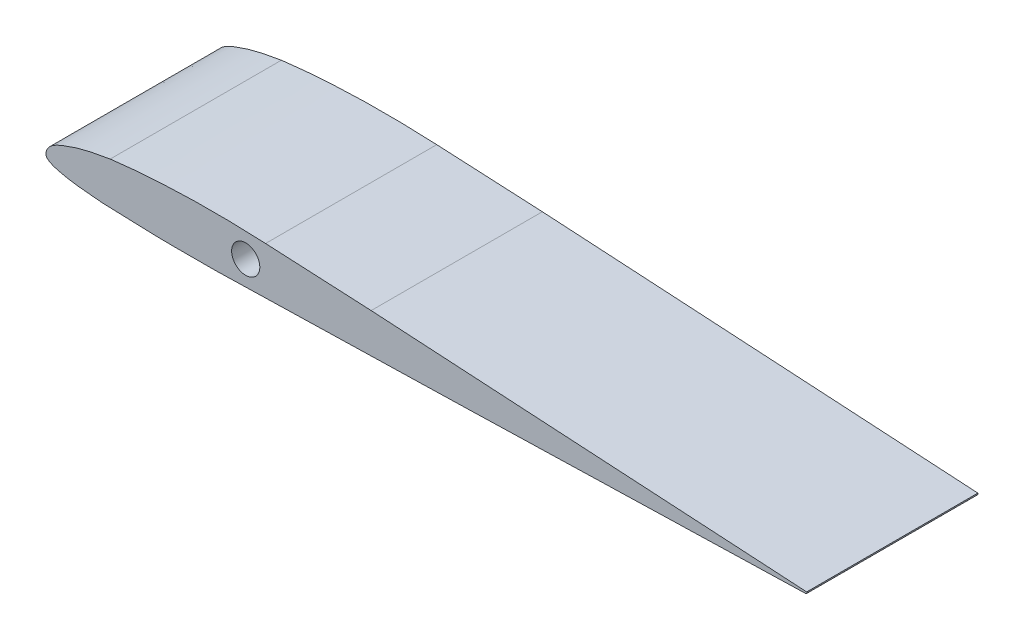
from build123d import *

# Parameters (mm, degrees)
AIRFOIL_DEPTH        = 45.72
CAMERA_CHANNEL_REACH = 211.044
SKETCH8_R            = 3.7592


with BuildPart() as part:
    # Sketch3 → Airfoil (new body)
    with BuildSketch(Plane.XY):
        with BuildLine():
            Line((202.994130812, 8.658655976), (110.583708873, 6.155294174))
            Line((110.583708873, 6.155294174), (45.243748526, 4.547671469))
            add(Edge.make_bspline(
                [(45.243748526, 4.547671469), (38.923572392, 4.568921268), (32.598685078, 4.437436548), (26.283676376, 4.693840567), (22.348358646, 4.853623607), (18.410196386, 4.937297779), (14.474878656, 5.097080819), (14.412947754, 5.099595357), (14.370093626, 5.173356562), (14.308475425, 5.180061537), (13.757234945, 5.240044692), (0.092319138, 5.933082267), (0.001596992, 8.740633601), (-0.083348667, 11.369421688), (3.240638559, 12.597933624), (5.152498304, 13.319770824), (6.702595853, 13.905021952), (8.281848193, 14.426252138), (9.890881707, 14.821641117), (12.262560893, 15.404435574), (14.691150833, 15.883501489), (17.149620686, 16.274957356)],
                knots=[0, 0, 0, 0, 1, 1, 1, 2, 2, 2, 3, 3, 3, 4, 4, 4, 5, 5, 5, 6, 6, 6, 6.272168289, 6.272168289, 6.272168289, 6.272168289], degree=3))
            add(Edge.make_bspline(
                [(17.149620686, 16.274957356), (28.832499255, 17.725653279), (42.670326445, 18.291936138), (58.641329464, 17.491030382)],
                knots=[0, 0, 0, 0, 1, 1, 1, 1], degree=3))
            Line((58.641329464, 17.491030382), (86.846468464, 16.076613382))
            Line((86.846468464, 16.076613382), (160.978559464, 11.666960382))
            Line((160.978559464, 11.666960382), (203.160688074, 9.157810196))
            ThreePointArc((203.160688074, 9.157810196), (203.180787666, 8.873737948), (202.994130812, 8.658655976))
        make_face()
    extrude(amount=AIRFOIL_DEPTH)

    # Sketch8 → Camera Channel (cut, up to next)
    with BuildSketch(Plane(origin=(0, 0, 0), x_dir=(-1, 0, 0), z_dir=(0, 0, -1)), mode=Mode.PRIVATE) as camera_channel_sk1:
        with Locations((-53.34, 11.228365492)):
            Circle(SKETCH8_R)
    camera_channel_tool1 = extrude(camera_channel_sk1.sketch, amount=-CAMERA_CHANNEL_REACH, mode=Mode.PRIVATE) & part.part
    add(camera_channel_tool1.solids().sort_by_distance((53.34, 11.228365, 0))[0], mode=Mode.SUBTRACT)


solid = part.part
